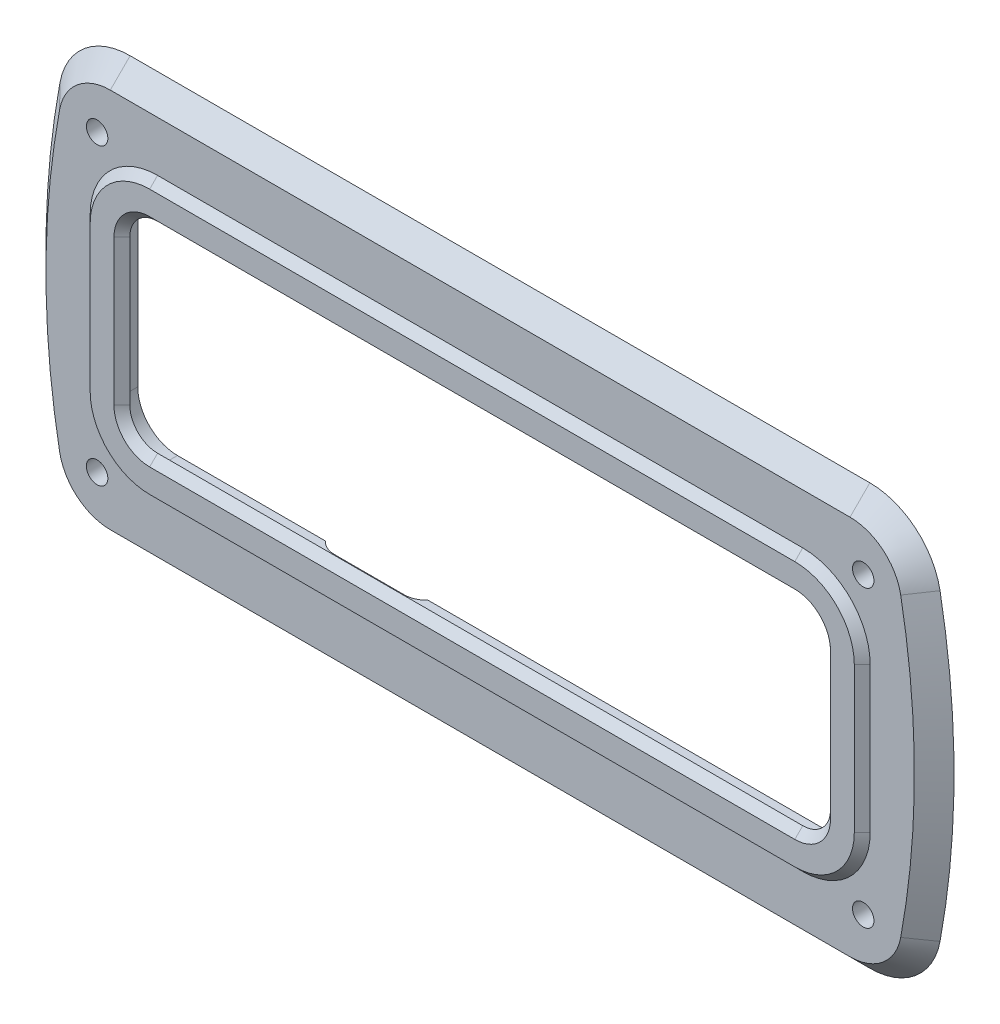
from build123d import *

# Parameters (mm, degrees)
SKETCH1_R           = 1.35
SKETCH1_R_2         = 1.353883359
BOSS_EXTRUDE1_DEPTH = 2.5
BOSS_EXTRUDE2_DEPTH = 1
CHAMFER1_SIZE       = 1
CHAMFER2_SIZE       = 2.5
CUT_EXTRUDE1_REACH  = 65.837


with BuildPart() as part:
    # Sketch1 → Boss-Extrude1 (new body)
    with BuildSketch(Plane.XY):
        with BuildLine():
            Line((-46.266968928, -27.305569911), (46.983031072, -27.305569911))
            ThreePointArc((46.983031072, -27.305569911), (52.736028884, -25.226770397), (55.831398017, -19.950684615))
            ThreePointArc((55.831398017, -19.950684615), (57.596036195, -0.805569911), (55.831398017, 18.339544793))
            ThreePointArc((55.831398017, 18.339544793), (52.736028884, 23.615630575), (46.983031072, 25.694430089))
            Line((46.983031072, 25.694430089), (-46.266968928, 25.694430089))
            ThreePointArc((-46.266968928, 25.694430089), (-52.019966741, 23.615630575), (-55.115335874, 18.339544793))
            ThreePointArc((-55.115335874, 18.339544793), (-56.879974052, -0.805569911), (-55.115335874, -19.950684615))
            ThreePointArc((-55.115335874, -19.950684615), (-52.019966741, -25.226770397), (-46.266968928, -27.305569911))
        make_face()
        with Locations((48.647296931, -19.366437107)):
            Circle(SKETCH1_R, mode=Mode.SUBTRACT)
        with Locations((48.647296931, 17.755297285)):
            Circle(SKETCH1_R, mode=Mode.SUBTRACT)
        with Locations((-47.931234788, 17.755297285)):
            Circle(SKETCH1_R, mode=Mode.SUBTRACT)
        with Locations((-47.931234788, -19.366437107)):
            Circle(SKETCH1_R_2, mode=Mode.SUBTRACT)
        with BuildLine():
            Line((-40.306968928, -14.970569911), (41.023031072, -14.970569911))
            ThreePointArc((41.023031072, -14.970569911), (44.558564977, -13.506103817), (46.023031072, -9.970569911))
            Line((46.023031072, -9.970569911), (46.023031072, 8.359430089))
            ThreePointArc((46.023031072, 8.359430089), (44.558564977, 11.894963995), (41.023031072, 13.359430089))
            Line((41.023031072, 13.359430089), (-40.306968928, 13.359430089))
            ThreePointArc((-40.306968928, 13.359430089), (-43.842502834, 11.894963995), (-45.306968928, 8.359430089))
            Line((-45.306968928, 8.359430089), (-45.306968928, -9.970569911))
            ThreePointArc((-45.306968928, -9.970569911), (-43.842502834, -13.506103817), (-40.306968928, -14.970569911))
        make_face(mode=Mode.SUBTRACT)
    extrude(amount=BOSS_EXTRUDE1_DEPTH)

    # Sketch2 → Boss-Extrude2 (add)
    with BuildSketch(Plane.XY.offset(2.5)):
        with BuildLine():
            Line((49.523031072, -9.970569911), (49.523031072, 8.359430089))
            ThreePointArc((49.523031072, 8.359430089), (47.033438712, 14.369837729), (41.023031072, 16.859430089))
            Line((41.023031072, 16.859430089), (-40.306968928, 16.859430089))
            ThreePointArc((-40.306968928, 16.859430089), (-46.317376569, 14.369837729), (-48.806968928, 8.359430089))
            Line((-48.806968928, 8.359430089), (-48.806968928, -9.970569911))
            ThreePointArc((-48.806968928, -9.970569911), (-46.317376569, -15.980977551), (-40.306968928, -18.470569911))
            Line((-40.306968928, -18.470569911), (41.023031072, -18.470569911))
            ThreePointArc((41.023031072, -18.470569911), (47.033438712, -15.980977551), (49.523031072, -9.970569911))
        make_face()
        with BuildLine():
            Line((41.023031072, 11.859430089), (-40.306968928, 11.859430089))
            ThreePointArc((-40.306968928, 11.859430089), (-42.781842663, 10.834303823), (-43.806968928, 8.359430089))
            Line((-43.806968928, 8.359430089), (-43.806968928, -9.970569911))
            ThreePointArc((-43.806968928, -9.970569911), (-42.781842663, -12.445443645), (-40.306968928, -13.470569911))
            Line((-40.306968928, -13.470569911), (41.023031072, -13.470569911))
            ThreePointArc((41.023031072, -13.470569911), (43.497904806, -12.445443645), (44.523031072, -9.970569911))
            Line((44.523031072, -9.970569911), (44.523031072, 8.359430089))
            ThreePointArc((44.523031072, 8.359430089), (43.497904806, 10.834303823), (41.023031072, 11.859430089))
        make_face(mode=Mode.SUBTRACT)
    extrude(amount=BOSS_EXTRUDE2_DEPTH)

    # Chamfer1
    chamfer1_edges = [part.edges().sort_by_distance(p)[0] for p in [
        (-42.781842663, 10.834303823, 3.5),
        (-43.806968928, -0.805569911, 3.5),
        (-42.781842663, -12.445443645, 3.5),
        (0.358031072, -13.470569911, 3.5),
        (43.497904806, -12.445443645, 3.5),
        (44.523031072, -0.805569911, 3.5),
        (43.497904806, 10.834303823, 3.5),
        (0.358031072, 11.859430089, 3.5),
        (49.523031072, -0.805569911, 3.5),
        (47.033438712, -15.980977551, 3.5),
        (0.358031072, -18.470569911, 3.5),
        (-46.317376569, -15.980977551, 3.5),
        (-48.806968928, -0.805569911, 3.5),
        (-46.317376569, 14.369837729, 3.5),
        (0.358031072, 16.859430089, 3.5),
        (47.033438712, 14.369837729, 3.5),
    ]]
    chamfer(chamfer1_edges, length=CHAMFER1_SIZE - 0.0001)  # a hair under: the kernel refuses the full size

    # Chamfer2
    chamfer2_edges = [part.edges().sort_by_distance(p)[0] for p in [
        (0.358031072, -27.305569911, 2.5),
        (52.736028884, -25.226770397, 2.5),
        (-52.019966741, -25.226770397, 2.5),
        (57.596036195, -0.805569911, 2.5),
        (-56.879974052, -0.805569911, 2.5),
        (52.736028884, 23.615630575, 2.5),
        (-52.019966741, 23.615630575, 2.5),
        (0.358031072, 25.694430089, 2.5),
    ]]
    chamfer(chamfer2_edges, length=CHAMFER2_SIZE - 0.0001)  # a hair under: the kernel refuses the full size

    # Sketch5 → Cut-Extrude1 (cut, up to next)
    with BuildSketch(Plane(origin=(0, 0, 0), x_dir=(1, 0, 0), z_dir=(0, 1, 0)), mode=Mode.PRIVATE) as cut_extrude1_sk1:
        with BuildLine():
            Line((-19.592815412, -0.909530151), (-10.792772138, -0.909530149))
            add(Edge.make_bspline(
                [(-10.792772138, -0.909530149), (-10.607889911, -0.909514148), (-10.425811047, -0.891482678), (-10.067163044, -0.820012158), (-9.888892808, -0.766003184), (-9.551032167, -0.625859061), (-9.390406566, -0.539750951), (-9.085426061, -0.336116729), (-8.94182552, -0.218381132), (-8.684308041, 0.03965313), (-8.5680613, 0.180457001), (-8.362346878, 0.487291556), (-8.276792708, 0.648789775), (-8.136603309, 0.98510143), (-8.08283068, 1.162298316), (-8.011186114, 1.523060599), (-7.992824871, 1.70562035), (-7.992815412, 1.890469849)],
                knots=[0, 0, 0, 0, 0.125, 0.125, 0.25, 0.25, 0.375, 0.375, 0.5, 0.5, 0.625, 0.625, 0.75, 0.75, 0.875, 0.875, 1, 1, 1, 1], degree=3))
            Line((-7.992815412, 1.890469849), (-7.992815414, 4.590513396))
            add(Edge.make_bspline(
                [(-7.992815414, 4.590513396), (-7.992831516, 4.77539614), (-8.010862926, 4.957475483), (-8.082333794, 5.316124243), (-8.136342538, 5.494395104), (-8.276486434, 5.832256678), (-8.36259727, 5.992880987), (-8.566235233, 6.297859231), (-8.683965434, 6.441464903), (-8.94199783, 6.698983866), (-9.082807296, 6.815224132), (-9.389639852, 7.020938991), (-9.551138299, 7.106493896), (-9.887450056, 7.246680754), (-10.064645109, 7.300455528), (-10.425407019, 7.372099354), (-10.607966433, 7.390460335), (-10.792815412, 7.39046985)],
                knots=[0, 0, 0, 0, 0.125, 0.125, 0.25, 0.25, 0.375, 0.375, 0.5, 0.5, 0.625, 0.625, 0.75, 0.75, 0.875, 0.875, 1, 1, 1, 1], degree=3))
            Line((-10.792815412, 7.39046985), (-19.592859134, 7.390469847))
            add(Edge.make_bspline(
                [(-19.592859134, 7.390469847), (-19.777741324, 7.39045368), (-19.95982018, 7.372422237), (-20.318468162, 7.300951771), (-20.496738382, 7.246942784), (-20.834598951, 7.106798619), (-20.995224508, 7.020690495), (-21.300204927, 6.817056293), (-21.443805472, 6.699320682), (-21.701322913, 6.441286422), (-21.817569624, 6.300482564), (-22.023283979, 5.993648079), (-22.108838169, 5.832149812), (-22.249027542, 5.495838191), (-22.302800153, 5.318641354), (-22.374444712, 4.957879073), (-22.392805954, 4.775319331), (-22.392815413, 4.590469849)],
                knots=[0, 0, 0, 0, 0.125, 0.125, 0.25, 0.25, 0.375, 0.375, 0.5, 0.5, 0.625, 0.625, 0.75, 0.75, 0.875, 0.875, 1, 1, 1, 1], degree=3))
            Line((-22.392815413, 4.590469849), (-22.39281541, 1.890426302))
            add(Edge.make_bspline(
                [(-22.39281541, 1.890426302), (-22.392799308, 1.705543556), (-22.374767902, 1.523464217), (-22.303297034, 1.164815473), (-22.249288291, 0.986544615), (-22.109144391, 0.648683022), (-22.023033556, 0.488058712), (-21.819395604, 0.183080482), (-21.701665392, 0.039474796), (-21.443632989, -0.218044171), (-21.302823525, -0.334284433), (-20.995990998, -0.539999282), (-20.834492517, -0.625554209), (-20.498180754, -0.765741045), (-20.320985718, -0.819515805), (-19.960223809, -0.89115971), (-19.777664402, -0.909520761), (-19.592815412, -0.909530151)],
                knots=[0, 0, 0, 0, 0.125, 0.125, 0.25, 0.25, 0.375, 0.375, 0.5, 0.5, 0.625, 0.625, 0.75, 0.75, 0.875, 0.875, 1, 1, 1, 1], degree=3))
        make_face()
    cut_extrude1_tool1 = extrude(cut_extrude1_sk1.sketch, amount=-CUT_EXTRUDE1_REACH, mode=Mode.PRIVATE) & part.part
    add(cut_extrude1_tool1.solids().sort_by_distance((-15.192815, 0, -3.240461))[0], mode=Mode.SUBTRACT)


solid = part.part
